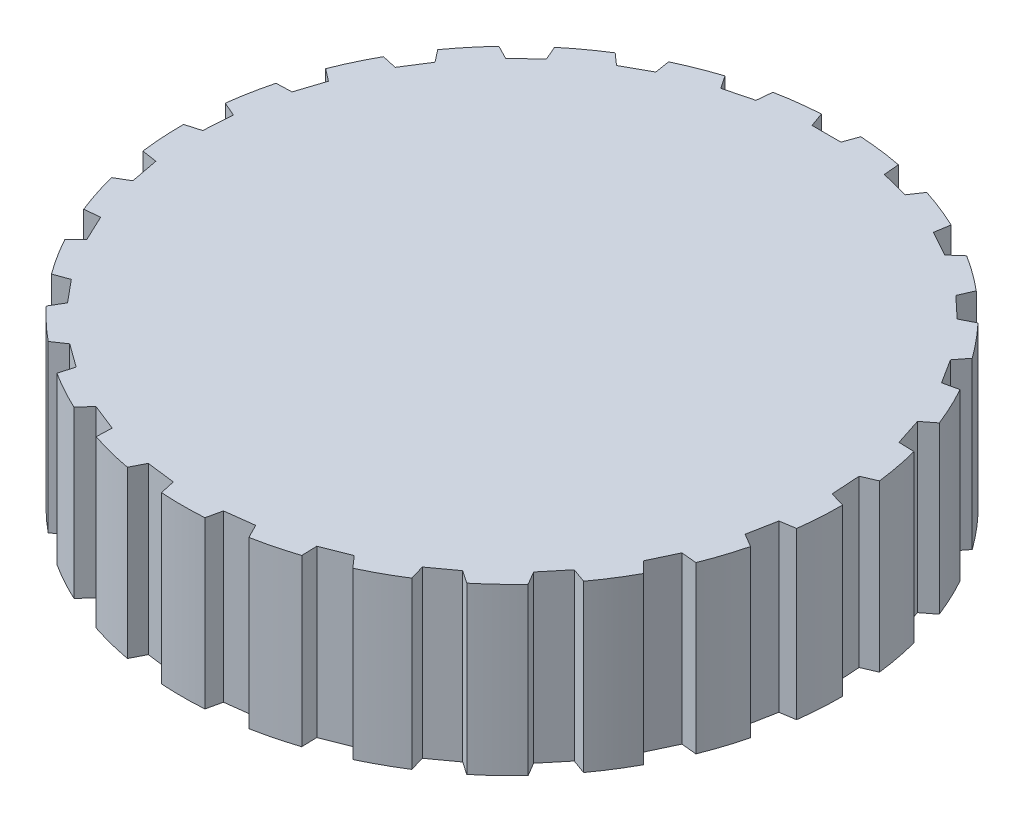
from build123d import *

# Parameters (mm, degrees)
SKETCH5_R           = 37.8968
BOSS_EXTRUDE2_DEPTH = 19.05
CUT_EXTRUDE1_DEPTH  = 22.05
CIRPATTERN1_COUNT   = 25


with BuildPart() as part:
    # Sketch5 → Boss-Extrude2 (new body)
    with BuildSketch(Plane(origin=(0, 0, 0), x_dir=(1, 0, 0), z_dir=(0, 1, 0))):
        Circle(SKETCH5_R)
    extrude(amount=BOSS_EXTRUDE2_DEPTH)

    # Sketch8 → Cut-Extrude1 (cut)
    with BuildSketch(Plane(origin=(0, 19.05, 0), x_dir=(1, 0, 0), z_dir=(0, 1, 0))):
        Polygon((0, 38.1), (2.36, 38.1), (1.66, 36.15), (0, 36.15), (-1.66, 36.15), (-2.36, 38.1), align=None)
    cut_extrude1 = extrude(amount=-CUT_EXTRUDE1_DEPTH, mode=Mode.SUBTRACT)

    # CirPattern1: Cut-Extrude1 ×25 about axis
    cirpattern1_axis = Axis((0, 19.05, 0), (0, 1, 0))
    for i in range(1, CIRPATTERN1_COUNT):
        add(cut_extrude1.rotate(cirpattern1_axis, i * 360 / CIRPATTERN1_COUNT), mode=Mode.SUBTRACT)


solid = part.part
